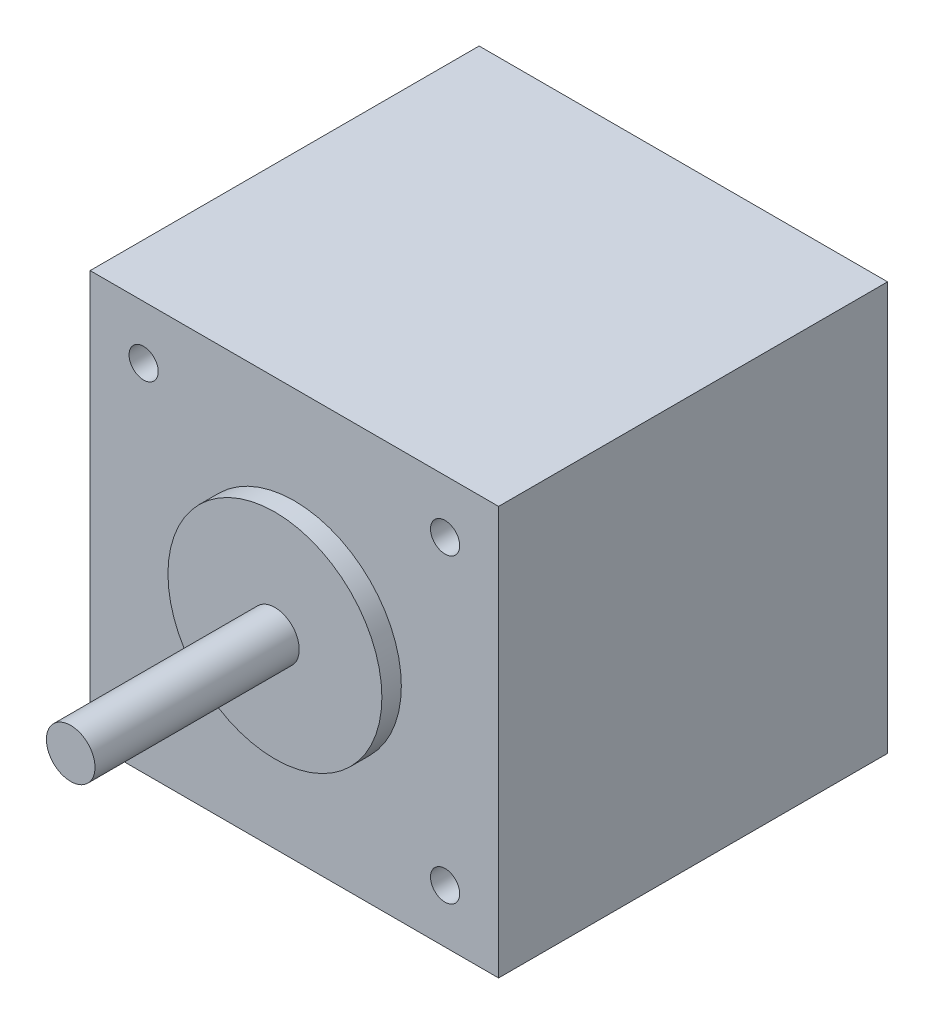
from build123d import *

# Parameters (mm, degrees)
SKETCH_1_W          = 42
SKETCH_1_H          = 42
EXTRUDE_1305_DEPTH  = 40
SKETCH_2_R          = 2.5
EXTRUDE_1360_DEPTH  = 63
SKETCH_3_R          = 11
EXTRUDE_1407_DEPTH  = 42
CUT_EXTRUDE_START   = 40
SKETCH_4_R          = 1.5
CUT_EXTRUDE_3_DEPTH = 4.5


with BuildPart() as part:
    # Эскиз1 → Extrude 1305 (new body)
    with BuildSketch(Plane.XY):
        Rectangle(SKETCH_1_W, SKETCH_1_H)
    extrude(amount=EXTRUDE_1305_DEPTH)

    # Эскиз2 → Extrude 1360 (add)
    with BuildSketch(Plane.XY):
        Circle(SKETCH_2_R)
    extrude(amount=EXTRUDE_1360_DEPTH)

    # Эскиз3 → Extrude 1407 (add)
    with BuildSketch(Plane.XY):
        Circle(SKETCH_3_R)
    extrude(amount=EXTRUDE_1407_DEPTH)

    # Эскиз4 → Крепеж_М3_ПРЕДВ (cut)
    with BuildSketch(Plane.XY.offset(CUT_EXTRUDE_START)):
        with Locations((-15.5, -15.5)):
            Circle(SKETCH_4_R)
        with Locations((-15.5, 15.5)):
            Circle(SKETCH_4_R)
        with Locations((15.5, -15.5)):
            Circle(SKETCH_4_R)
        with Locations((15.5, 15.5)):
            Circle(SKETCH_4_R)
    extrude(amount=-CUT_EXTRUDE_3_DEPTH, mode=Mode.SUBTRACT)


solid = part.part
